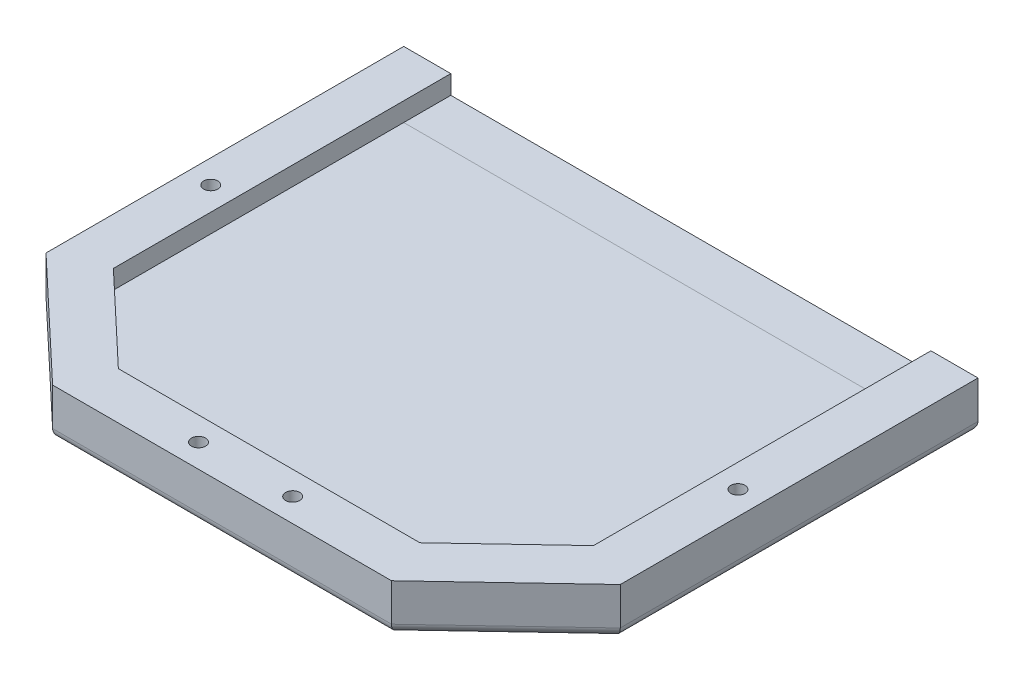
from build123d import *

# Parameters (mm, degrees)
DODANIE_WYCI_GNI_CIE1_DEPTH       = 3
WYCI_GNI_CIE_CIENKA_CIANKA2_DEPTH = 2
WYTNIJ_WYCI_GNI_CIE1_DEPTH        = 27
WYTNIJ_WYCI_GNI_CIE1_DEPTH_BACK   = 40
SZKIC3_R                          = 0.75
ZAOKR_GLENIE2_R                   = 1
WYTNIJ_WYCI_GNI_CIE2_DEPTH        = 100.81161788
WYTNIJ_WYCI_GNI_CIE2_DEPTH_BACK   = 0.0001
SZKIC4_W                          = 51
SZKIC4_H                          = 5


with BuildPart() as part:
    # Szkic1 → Dodanie-wyciągnięcie1 (new body)
    with BuildSketch(Plane(origin=(0, 0, 0), x_dir=(1, 0, 0), z_dir=(0, 1, 0))):
        Polygon((-24.742105263, -43.144736842), (36.257894737, -43.144736842), (36.257894737, -81.144736842), (23.757894737, -92.944736842), (-12.242105263, -92.944736842), (-24.742105263, -81.144736842), align=None)
    extrude(amount=DODANIE_WYCI_GNI_CIE1_DEPTH)

    # Szkic2 → Wyciągnięcie-cienka ścianka2 (add)
    with BuildSketch(Plane(origin=(0, 3, 0), x_dir=(1, 0, 0), z_dir=(0, 1, 0))):
        Polygon((23.757894737, -92.944736842), (-12.242105263, -92.944736842), (-24.742105263, -81.144736842), (-24.742105263, -43.144736842), (36.257894737, -43.144736842), (36.257894737, -81.144736842), align=None)
        Polygon((21.770681783, -87.944736842), (-10.25489231, -87.944736842), (-19.742105263, -78.988807814), (-19.742105263, -48.144736842), (31.257894737, -48.144736842), (31.257894737, -78.988807814), align=None, mode=Mode.SUBTRACT)
    extrude(amount=WYCI_GNI_CIE_CIENKA_CIANKA2_DEPTH)

    # Szkic3 → Wytnij-wyciągnięcie1 (cut, two sides: drawn at the far end of the back side and taken through both)
    with BuildSketch(Plane(origin=(0, 5, 0), x_dir=(1, 0, 0), z_dir=(0, 1, 0)).offset(-WYTNIJ_WYCI_GNI_CIE1_DEPTH_BACK)):
        with Locations(Location((0.757894737, -90.444736842, 0), (0, 0, 90))):
            Circle(SZKIC3_R)
        with Locations(Location((10.757894737, -90.444736842, 0), (0, 0, 90))):
            Circle(SZKIC3_R)
        with Locations(Location((-22.242105263, -66.144736842, 0), (0, 0, 90))):
            Circle(SZKIC3_R)
        with Locations(Location((33.757894737, -66.144736842, 0), (0, 0, 90))):
            Circle(SZKIC3_R)
    extrude(amount=WYTNIJ_WYCI_GNI_CIE1_DEPTH + WYTNIJ_WYCI_GNI_CIE1_DEPTH_BACK, mode=Mode.SUBTRACT)

    # Zaokrąglenie2
    # the kernel refuses this fillet: 1 mm, written as the material it takes off along each edge
    with BuildSketch(Plane(origin=(33.757894737, 0, 66.144736842), x_dir=(0, 0, -1), z_dir=(1, 0, 0))) as zaokr_glenie2_piece_1:
        with BuildLine():
            CenterArc((0.75 + ZAOKR_GLENIE2_R, ZAOKR_GLENIE2_R), ZAOKR_GLENIE2_R, 180, 90)
            Line((0.75, ZAOKR_GLENIE2_R), (0.75, 0))
            Line((0.75, 0), (0.75 + ZAOKR_GLENIE2_R, 0))
        make_face()
    revolve(axis=Axis((33.757894737, 0, 66.144736842), (0, 1, 0)), mode=Mode.SUBTRACT)
    with BuildSketch(Plane(origin=(-22.242105263, 0, 66.144736842), x_dir=(0, 0, -1), z_dir=(1, 0, 0))) as zaokr_glenie2_piece_2:
        with BuildLine():
            CenterArc((0.75 + ZAOKR_GLENIE2_R, ZAOKR_GLENIE2_R), ZAOKR_GLENIE2_R, 180, 90)
            Line((0.75, ZAOKR_GLENIE2_R), (0.75, 0))
            Line((0.75, 0), (0.75 + ZAOKR_GLENIE2_R, 0))
        make_face()
    revolve(axis=Axis((-22.242105263, 0, 66.144736842), (0, 1, 0)), mode=Mode.SUBTRACT)
    with BuildSketch(Plane(origin=(-27.242105263, 0, 43.144736842), x_dir=(0, 1, 0), z_dir=(1, 0, 0))) as zaokr_glenie2_piece_3:
        with BuildLine():
            CenterArc((ZAOKR_GLENIE2_R, ZAOKR_GLENIE2_R), ZAOKR_GLENIE2_R, 180, 90)
            Line((0, ZAOKR_GLENIE2_R), (0, 0))
            Line((0, 0), (ZAOKR_GLENIE2_R, 0))
        make_face()
    extrude(amount=66, mode=Mode.SUBTRACT)
    with BuildSketch(Plane(origin=(10.757894737, 0, 90.444736842), x_dir=(0, 0, -1), z_dir=(1, 0, 0))) as zaokr_glenie2_piece_4:
        with BuildLine():
            CenterArc((0.75 + ZAOKR_GLENIE2_R, ZAOKR_GLENIE2_R), ZAOKR_GLENIE2_R, 180, 90)
            Line((0.75, ZAOKR_GLENIE2_R), (0.75, 0))
            Line((0.75, 0), (0.75 + ZAOKR_GLENIE2_R, 0))
        make_face()
    revolve(axis=Axis((10.757894737, 0, 90.444736842), (0, 1, 0)), mode=Mode.SUBTRACT)
    with BuildSketch(Plane(origin=(36.257894737, 0, 40.644736842), x_dir=(0, 1, 0), z_dir=(0, 0, 1)), Plane(origin=(-24.742105263, 0, 83.644736842), x_dir=(0, 1, 0), z_dir=(0, 0, -1))) as zaokr_glenie2_piece_5:
        with BuildLine():
            CenterArc((ZAOKR_GLENIE2_R, ZAOKR_GLENIE2_R), ZAOKR_GLENIE2_R, 180, 90)
            Line((0, ZAOKR_GLENIE2_R), (0, 0))
            Line((0, 0), (ZAOKR_GLENIE2_R, 0))
        make_face()
    extrude(amount=43, mode=Mode.SUBTRACT)
    with BuildSketch(Plane(origin=(0.757894737, 0, 90.444736842), x_dir=(0, 0, -1), z_dir=(1, 0, 0))) as zaokr_glenie2_piece_6:
        with BuildLine():
            CenterArc((0.75 + ZAOKR_GLENIE2_R, ZAOKR_GLENIE2_R), ZAOKR_GLENIE2_R, 180, 90)
            Line((0.75, ZAOKR_GLENIE2_R), (0.75, 0))
            Line((0.75, 0), (0.75 + ZAOKR_GLENIE2_R, 0))
        make_face()
    revolve(axis=Axis((0.757894737, 0, 90.444736842), (0, 1, 0)), mode=Mode.SUBTRACT)
    with BuildSketch(Plane(origin=(38.075830895, 0, 79.428605109), x_dir=(-0.6864526932555783, 0, -0.7271744631944682), z_dir=(-0.7271744631944682, 0, 0.6864526932555782)), Plane(origin=(-10.424169105, 0, 94.660868575), x_dir=(0.686452693255578, 0, -0.7271744631944684), z_dir=(-0.7271744631944684, 0, -0.686452693255578))) as zaokr_glenie2_piece_7:
        with BuildLine():
            CenterArc((ZAOKR_GLENIE2_R, -ZAOKR_GLENIE2_R), ZAOKR_GLENIE2_R, 90, 90)
            Line((0, -ZAOKR_GLENIE2_R), (0, 0))
            Line((0, 0), (ZAOKR_GLENIE2_R, 0))
        make_face()
    extrude(amount=22.18982257, mode=Mode.SUBTRACT)
    with BuildSketch(Plane(origin=(26.257894737, 0, 92.944736842), x_dir=(0, 0, -1), z_dir=(-1, 0, 0))) as zaokr_glenie2_piece_8:
        with BuildLine():
            CenterArc((ZAOKR_GLENIE2_R, -ZAOKR_GLENIE2_R), ZAOKR_GLENIE2_R, 90, 90)
            Line((0, -ZAOKR_GLENIE2_R), (0, 0))
            Line((0, 0), (ZAOKR_GLENIE2_R, 0))
        make_face()
    extrude(amount=41, mode=Mode.SUBTRACT)

    # Szkic4 → Wytnij-wyciągnięcie2 (cut, two sides: drawn at the far end of the back side and taken through both)
    with BuildSketch(Plane(origin=(0, 3, 0), x_dir=(1, 0, 0), z_dir=(0, 1, 0)).offset(-WYTNIJ_WYCI_GNI_CIE2_DEPTH_BACK)):
        with Locations((5.757894737, -45.644736842)):
            Rectangle(SZKIC4_W, SZKIC4_H)
    extrude(amount=WYTNIJ_WYCI_GNI_CIE2_DEPTH + WYTNIJ_WYCI_GNI_CIE2_DEPTH_BACK, mode=Mode.SUBTRACT)


solid = part.part
